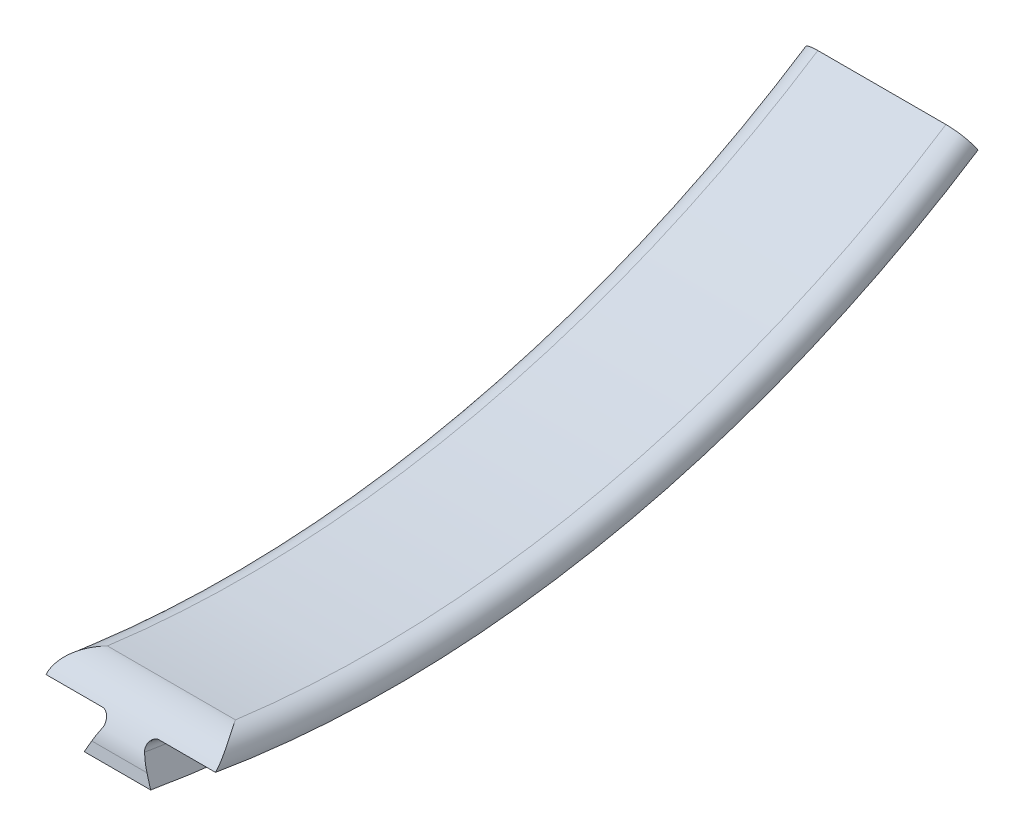
from build123d import *

# Parameters (mm, degrees)
REVOLVE1_ANGLE           = 33
REVOLVE1_OTHER_WAY_ANGLE = 10
FILLET1_START            = -5
FILLET1_DEPTH            = 10


with BuildPart() as part:
    # Sketch1 → Revolve1 (revolve)
    with BuildSketch(Plane(origin=(0, 0, 0), x_dir=(1, 0, 0), z_dir=(0, 0, -1))):
        with BuildLine():
            Line((-3.640625, 46), (-1.217705098, 46))
            ThreePointArc((-1.217705098, 46), (-0.919977315, 46.165994111), (-0.904655581, 46.506524758))
            Line((-0.904655581, 46.506524758), (-1.426393202, 47.55))
            Line((-1.426393202, 47.55), (1.426393202, 47.55))
            Line((1.426393202, 47.55), (0.904655581, 46.506524758))
            ThreePointArc((0.904655581, 46.506524758), (0.919977315, 46.165994111), (1.217705098, 46))
            Line((1.217705098, 46), (3.640625, 46))
            ThreePointArc((3.640625, 46), (3.379766977, 45.370233023), (2.75, 45.109375))
            Line((2.75, 45.109375), (-2.75, 45.109375))
            ThreePointArc((-2.75, 45.109375), (-3.379766977, 45.370233023), (-3.640625, 46))
        make_face()
    revolve(axis=Axis((0, 0, 0), (1, 0, 0)), revolution_arc=REVOLVE1_ANGLE)

    # Sketch1 → Revolve1 other way (revolve)
    with BuildSketch(Plane(origin=(0, 0, 0), x_dir=(1, 0, 0), z_dir=(0, 0, -1))):
        with BuildLine():
            Line((-3.640625, 46), (-1.217705098, 46))
            ThreePointArc((-1.217705098, 46), (-0.919977315, 46.165994111), (-0.904655581, 46.506524758))
            Line((-0.904655581, 46.506524758), (-1.426393202, 47.55))
            Line((-1.426393202, 47.55), (1.426393202, 47.55))
            Line((1.426393202, 47.55), (0.904655581, 46.506524758))
            ThreePointArc((0.904655581, 46.506524758), (0.919977315, 46.165994111), (1.217705098, 46))
            Line((1.217705098, 46), (3.640625, 46))
            ThreePointArc((3.640625, 46), (3.379766977, 45.370233023), (2.75, 45.109375))
            Line((2.75, 45.109375), (-2.75, 45.109375))
            ThreePointArc((-2.75, 45.109375), (-3.379766977, 45.370233023), (-3.640625, 46))
        make_face()
    revolve(axis=Axis((0, 0, 0), (-1, 0, 0)), revolution_arc=REVOLVE1_OTHER_WAY_ANGLE)

    # Fillet1: read off the stored shape, not the designer's step
    # Fillet1 outline → Fillet1 (cut)
    with BuildSketch(Plane.YZ.offset(FILLET1_START)):
        with BuildLine():
            ThreePointArc((-46.351849466, 8.173081667), (-45.085567377, 7.385144883), (-44.716561853, 5.94010176))
            ThreePointArc((-44.716561853, 5.94010176), (-44.580361526, 6.888184024), (-44.424062234, 7.833160764))
            Line((-44.424062234, 7.833160764), (-46.351849466, 8.173081667))
        make_face()
    extrude(amount=FILLET1_DEPTH, mode=Mode.SUBTRACT)


solid = part.part
